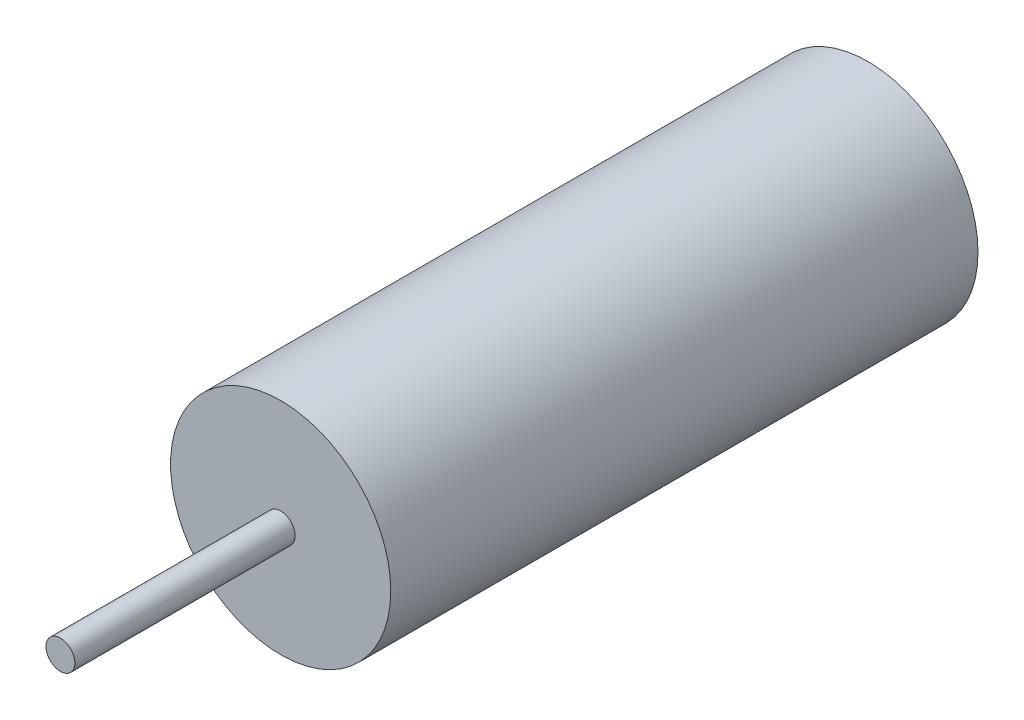
from build123d import *

# Parameters (mm, degrees)
SKETCH1_R           = 19.05
BOSS_EXTRUDE1_DEPTH = 101.6
SKETCH2_R           = 2.5
BOSS_EXTRUDE2_DEPTH = 38.1


with BuildPart() as part:
    # Sketch1 → Boss-Extrude1 (new body)
    with BuildSketch(Plane.XY):
        Circle(SKETCH1_R)
    extrude(amount=BOSS_EXTRUDE1_DEPTH)

    # Sketch2 → Boss-Extrude2 (add)
    with BuildSketch(Plane.XY.offset(101.6)):
        Circle(SKETCH2_R)
    extrude(amount=BOSS_EXTRUDE2_DEPTH)


solid = part.part
